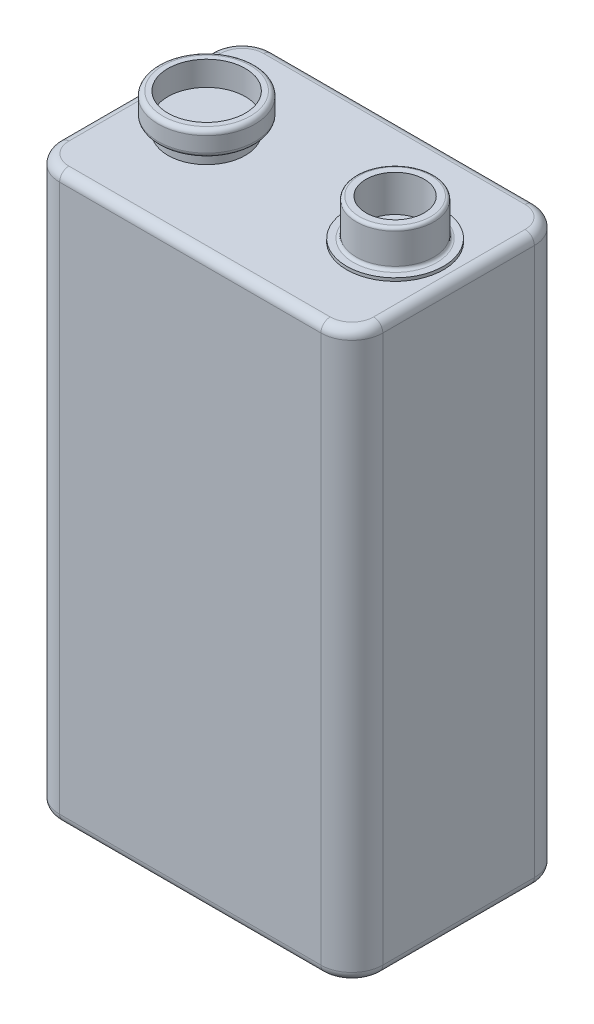
from build123d import *

# Parameters (mm, degrees)
SKETCH2_W           = 26.5
SKETCH2_H           = 46.4
BOSS_EXTRUDE1_DEPTH = 17.5
FILLET1_R           = 2.54
FILLET2_R           = 0.762
SKETCH3_R           = 3.96875
BOSS_EXTRUDE2_DEPTH = 0.254
SKETCH4_R           = 3.175
SKETCH4_R_2         = 2.3876
BOSS_EXTRUDE3_DEPTH = 3
FILLET3_R           = 0.254
SKETCH5_R           = 3.175
BOSS_EXTRUDE4_DEPTH = 1
SKETCH6_R           = 3.96875
SKETCH6_R_2         = 3.175
BOSS_EXTRUDE5_DEPTH = 2
FILLET4_R           = 0.381


with BuildPart() as part:
    # Sketch2 → Boss-Extrude1 (new body)
    with BuildSketch(Plane.XY):
        with Locations((13.25, 23.2)):
            Rectangle(SKETCH2_W, SKETCH2_H)
    extrude(amount=-BOSS_EXTRUDE1_DEPTH)

    # Fillet1
    fillet1_edges = [part.edges().sort_by_distance(p)[0] for p in [
        (0, 23.2, -17.5),
        (0, 23.2, 0),
        (26.5, 23.2, -17.5),
        (26.5, 23.2, 0),
    ]]
    fillet(fillet1_edges, radius=FILLET1_R)

    # Fillet2
    fillet2_edges = [part.edges().sort_by_distance(p)[0] for p in [
        (25.756051224, 46.4, -0.743948776),
        (26.5, 46.4, -8.75),
        (25.756051224, 46.4, -16.756051224),
        (13.25, 46.4, -17.5),
        (0.743948776, 46.4, -16.756051224),
        (0, 46.4, -8.75),
        (0.743948776, 46.4, -0.743948776),
        (0.743948776, 0, -0.743948776),
        (13.25, 0, 0),
        (25.756051224, 0, -0.743948776),
        (26.5, 0, -8.75),
        (25.756051224, 0, -16.756051224),
        (13.25, 0, -17.5),
        (0.743948776, 0, -16.756051224),
        (0, 0, -8.75),
        (13.25, 46.4, 0),
    ]]
    fillet(fillet2_edges, radius=FILLET2_R)

    # Sketch3 → Boss-Extrude2 (add)
    with BuildSketch(Plane(origin=(0, 46.4, 0), x_dir=(1, 0, 0), z_dir=(0, 1, 0))):
        with Locations((21.293, 8.75)):
            Circle(SKETCH3_R)
    extrude(amount=BOSS_EXTRUDE2_DEPTH)

    # Sketch4 → Boss-Extrude3 (add)
    with BuildSketch(Plane(origin=(0, 46.654, 0), x_dir=(1, 0, 0), z_dir=(0, 1, 0))):
        with Locations((21.293, 8.75)):
            Circle(SKETCH4_R)
        with Locations((21.293, 8.75)):
            Circle(SKETCH4_R_2, mode=Mode.SUBTRACT)
    extrude(amount=BOSS_EXTRUDE3_DEPTH)

    # Fillet3
    fillet3_edges = [part.edges().sort_by_distance(p)[0] for p in [
        (18.118, 49.654, -8.75),
        (18.118, 46.654, -8.75),
    ]]
    fillet(fillet3_edges, radius=FILLET3_R)

    # Sketch5 → Boss-Extrude4 (add)
    with BuildSketch(Plane(origin=(0, 46.4, 0), x_dir=(1, 0, 0), z_dir=(0, 1, 0))):
        with Locations((5.842, 8.75)):
            Circle(SKETCH5_R)
    extrude(amount=BOSS_EXTRUDE4_DEPTH)


with BuildPart() as body_2:
    # Sketch6 → Boss-Extrude5 (new body)
    with BuildSketch(Plane(origin=(0, 47.4, 0), x_dir=(1, 0, 0), z_dir=(0, 1, 0))):
        with Locations((5.842, 8.75)):
            Circle(SKETCH6_R)
        with Locations((5.842, 8.75)):
            Circle(SKETCH6_R_2, mode=Mode.SUBTRACT)
    extrude(amount=BOSS_EXTRUDE5_DEPTH)

    # Fillet4
    fillet4_edges = [body_2.edges().sort_by_distance(p)[0] for p in [
        (1.87325, 49.4, -8.75),
        (1.87325, 47.4, -8.75),
    ]]
    fillet(fillet4_edges, radius=FILLET4_R)


solid = Compound([part.part, body_2.part])
